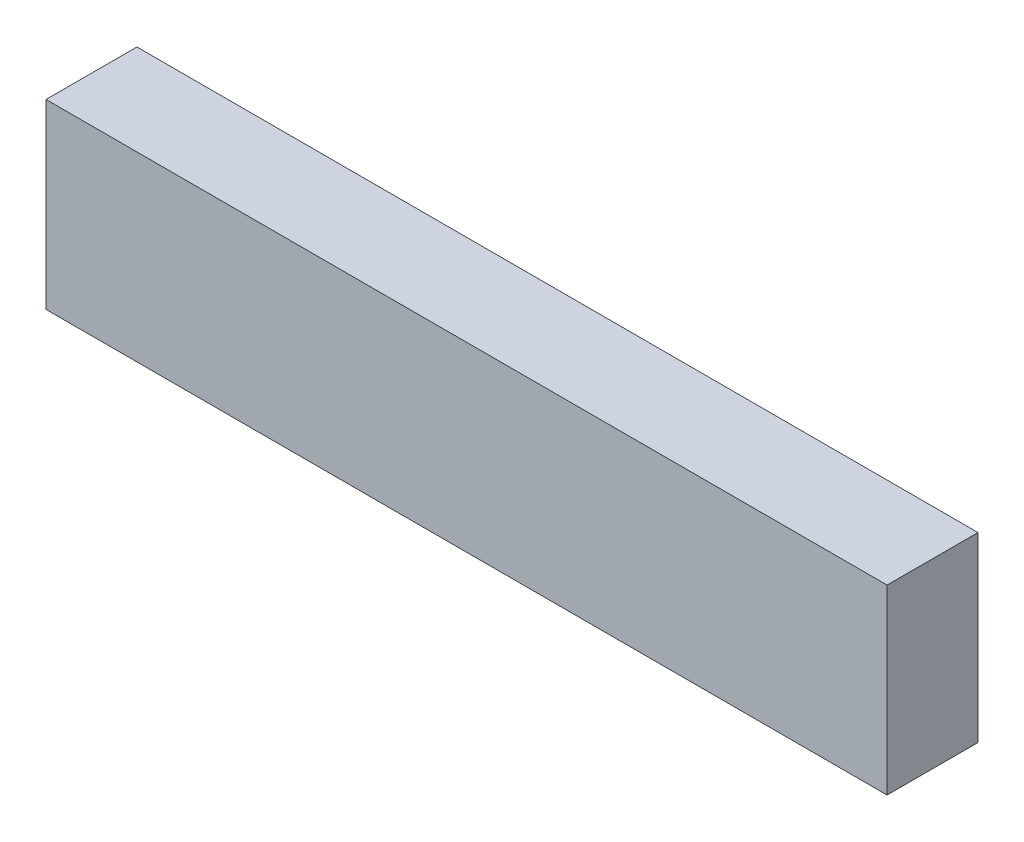
from build123d import *

# Parameters (mm, degrees)
SKETCH1_W           = 185
SKETCH1_H           = 40
BOSS_EXTRUDE1_DEPTH = 20


with BuildPart() as part:
    # Sketch1 → Boss-Extrude1 (new body)
    with BuildSketch(Plane.XY):
        Rectangle(SKETCH1_W, SKETCH1_H)
    extrude(amount=BOSS_EXTRUDE1_DEPTH)


solid = part.part
